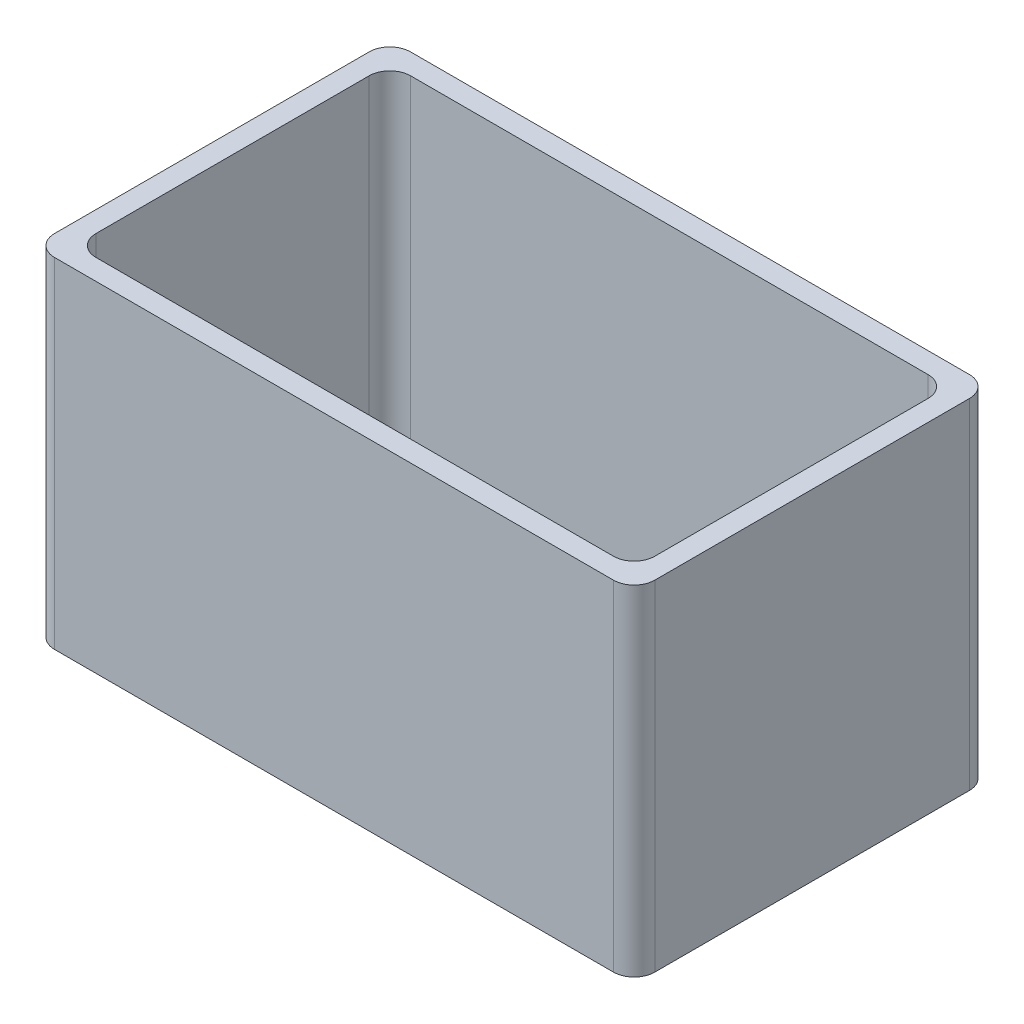
from build123d import *

# Parameters (mm, degrees)
CROQUIS1_W              = 290
CROQUIS1_H              = 164
SALIENTE_EXTRUIR1_DEPTH = 172
REDONDEO1_R             = 10
VACIADO1_START          = -135
VACIADO1_OUTLINE_W      = 154
VACIADO1_OUTLINE_H      = 152
VACIADO1_DEPTH          = 270
REDONDEO2_R             = 10


# Read off the part's stored shape, not the designer's step: Vaciado1
with BuildPart() as part:
    # Croquis1 → Saliente-Extruir1 (new body)
    with BuildSketch(Plane.XY):
        Rectangle(CROQUIS1_W, CROQUIS1_H)
    extrude(amount=SALIENTE_EXTRUIR1_DEPTH)

    # Redondeo1
    redondeo1_edges = [part.edges().sort_by_distance(p)[0] for p in [
        (-145, 0, 172),
        (145, 0, 172),
        (-145, 0, 0),
        (145, 0, 0),
    ]]
    fillet(redondeo1_edges, radius=REDONDEO1_R)

    # Vaciado1 outline → Vaciado1 (cut)
    with BuildSketch(Plane.YZ.offset(VACIADO1_START)):
        with Locations((5, 86)):
            Rectangle(VACIADO1_OUTLINE_W, VACIADO1_OUTLINE_H)
    extrude(amount=VACIADO1_DEPTH, mode=Mode.SUBTRACT)

    # Redondeo2
    redondeo2_edges = [part.edges().sort_by_distance(p)[0] for p in [
        (135, 5, 162),
        (-135, 5, 162),
        (-135, 5, 10),
        (135, 5, 10),
    ]]
    fillet(redondeo2_edges, radius=REDONDEO2_R)


solid = part.part
